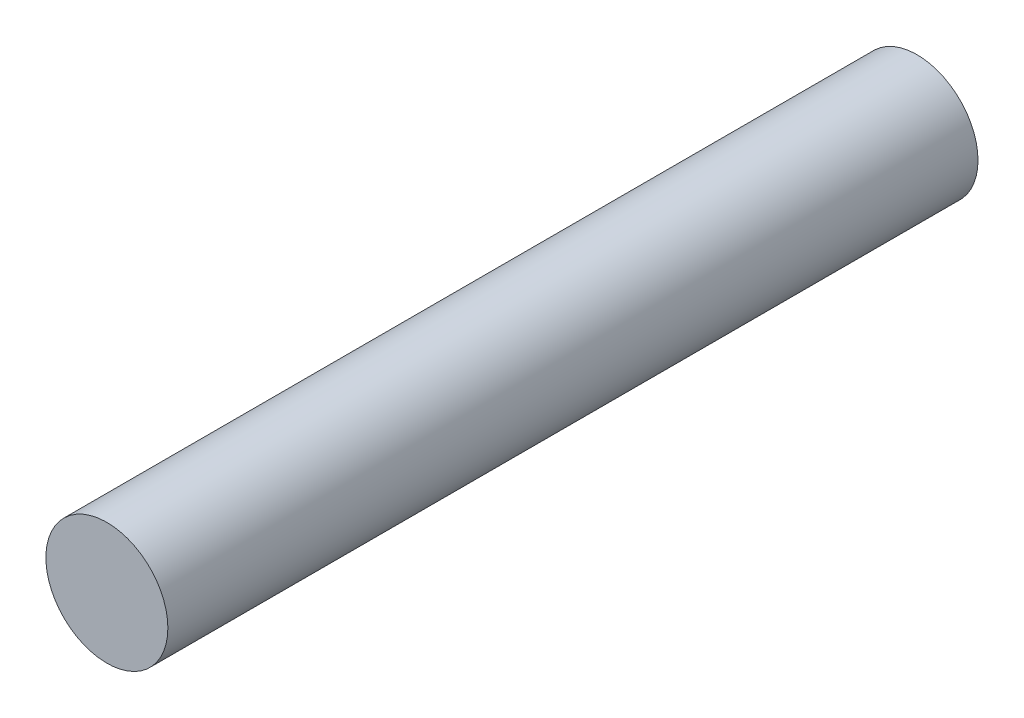
from build123d import *

# Parameters (mm, degrees)
BOSS_EXTRUDE1_OUTLINE_R = 6.35
BOSS_EXTRUDE1_DEPTH     = 84.3407


# Read off the part's stored shape, not the designer's step: Boss-Extrude1
with BuildPart() as part:
    # Boss-Extrude1 outline → Boss-Extrude1 (new body)
    with BuildSketch(Plane(origin=(0, 0, 70.8279), x_dir=(-1, 0, 0), z_dir=(0, 0, -1))):
        Circle(BOSS_EXTRUDE1_OUTLINE_R)
    extrude(amount=BOSS_EXTRUDE1_DEPTH)


solid = part.part
